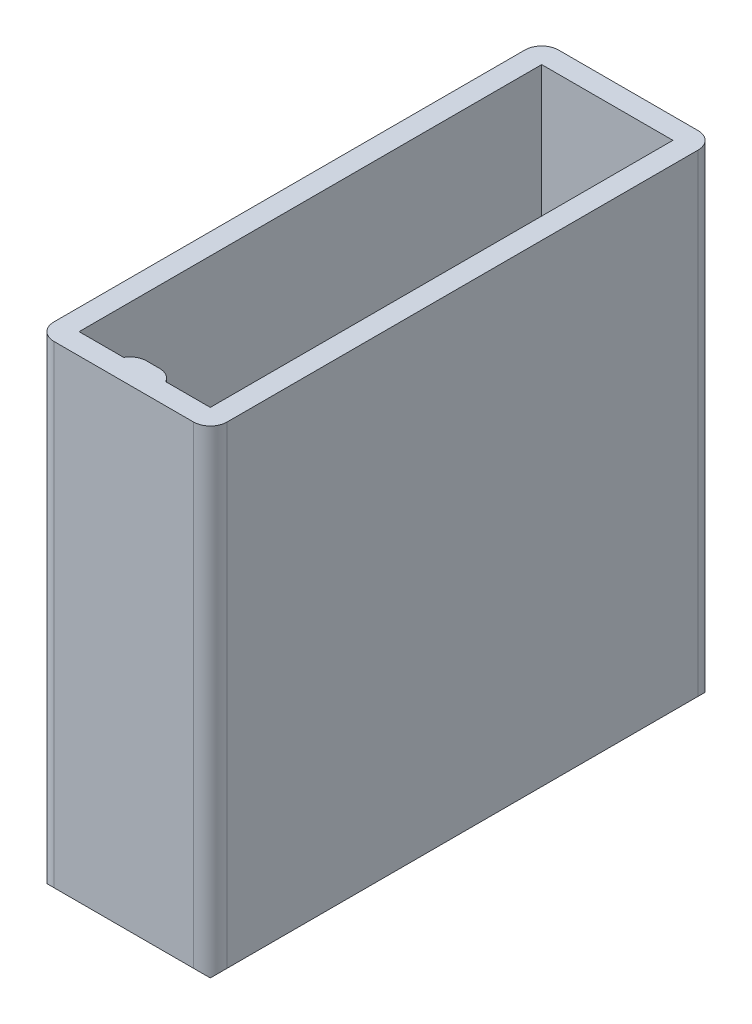
from build123d import *

# Parameters (mm, degrees)
SKETCH1_W           = 26.162
SKETCH1_H           = 76.2
BOSS_EXTRUDE1_DEPTH = 38.1
SKETCH2_W           = 19.812
SKETCH2_H           = 69.85
CUT_EXTRUDE1_DEPTH  = 73.025
CHAMFER1_SIZE       = 4.7625
SKETCH3_W           = 6.35
SKETCH3_H           = 0.7874
BOSS_EXTRUDE2_DEPTH = 1.27
FILLET1_R           = 2.54
FILLET2_R           = 2.54


with BuildPart() as part:
    # Sketch1 → Boss-Extrude1 (new, symmetric)
    with BuildSketch(Plane.XY):
        with Locations((-6.755190476, 6.28952381)):
            Rectangle(SKETCH1_W, SKETCH1_H)
    extrude(amount=BOSS_EXTRUDE1_DEPTH, both=True)

    # Sketch2 → Cut-Extrude1 (cut)
    with BuildSketch(Plane(origin=(0, 44.38952381, 0), x_dir=(1, 0, 0), z_dir=(0, 1, 0))):
        with Locations((-6.755190476, 0)):
            Rectangle(SKETCH2_W, SKETCH2_H)
    extrude(amount=-CUT_EXTRUDE1_DEPTH, mode=Mode.SUBTRACT)

    # Chamfer1
    chamfer1_edges = [part.edges().sort_by_distance(p)[0] for p in [
        (-6.755190476, -31.81047619, 38.1),
        (-6.755190476, -31.81047619, -38.1),
        (6.325809524, -31.81047619, 0),
        (-19.836190476, -31.81047619, 0),
    ]]
    chamfer(chamfer1_edges, length=CHAMFER1_SIZE)

    # Sketch3 → Boss-Extrude2 (add)
    with BuildSketch(Plane(origin=(0, 0, 34.925), x_dir=(-1, 0, 0), z_dir=(0, 0, -1))):
        with Locations((6.755190476, 43.99582381)):
            Rectangle(SKETCH3_W, SKETCH3_H)
    extrude(amount=BOSS_EXTRUDE2_DEPTH)

    # Fillet1
    fillet1_edges = [part.edges().sort_by_distance(p)[0] for p in [
        (6.325809524, 8.67077381, -38.1),
        (6.325809524, 8.67077381, 38.1),
        (-19.836190476, 8.67077381, -38.1),
        (-19.836190476, 8.67077381, 38.1),
    ]]
    fillet(fillet1_edges, radius=FILLET1_R)

    # Fillet2
    # the kernel refuses this fillet: 2.54 mm, written as the material it takes off along each edge
    with BuildSketch(Plane(origin=(-3.580190476, 49.888785124, 33.655), x_dir=(0, 0, 1), z_dir=(0, -1, 0))) as fillet2_piece_1:
        with BuildLine():
            CenterArc((2.54, 2.199704526), FILLET2_R, 180, 60)
            Line((0, 2.199704526), (-0.0508, 2.199704526))
            Line((-0.0508, 2.199704526), (-0.0508, 0))
            Line((-0.0508, 0), (0, -0.0508))
            ThreePointArc((0, -0.0508), (0.635, -0.0508), (1.2446, -0.043994091))
            Line((1.2446, -0.043994091), (1.27, 0))
        make_face()
    extrude(amount=11.785922628, mode=Mode.SUBTRACT)
    with BuildSketch(Plane(origin=(-9.930190476, 38.102862495, 33.655), x_dir=(1, 0, 0), z_dir=(0, 1, 0))) as fillet2_piece_2:
        with BuildLine():
            CenterArc((2.199704526, -2.54), FILLET2_R, 90, 60)
            Line((0, -1.27), (-0.043994091, -1.2446))
            ThreePointArc((-0.043994091, -1.2446), (-0.0508, -0.635), (-0.0508, 0))
            Line((-0.0508, 0), (0, 0.0508))
            Line((0, 0.0508), (2.199704526, 0.0508))
            Line((2.199704526, 0.0508), (2.199704526, 0))
        make_face()
    extrude(amount=11.785922628, mode=Mode.SUBTRACT)


solid = part.part
